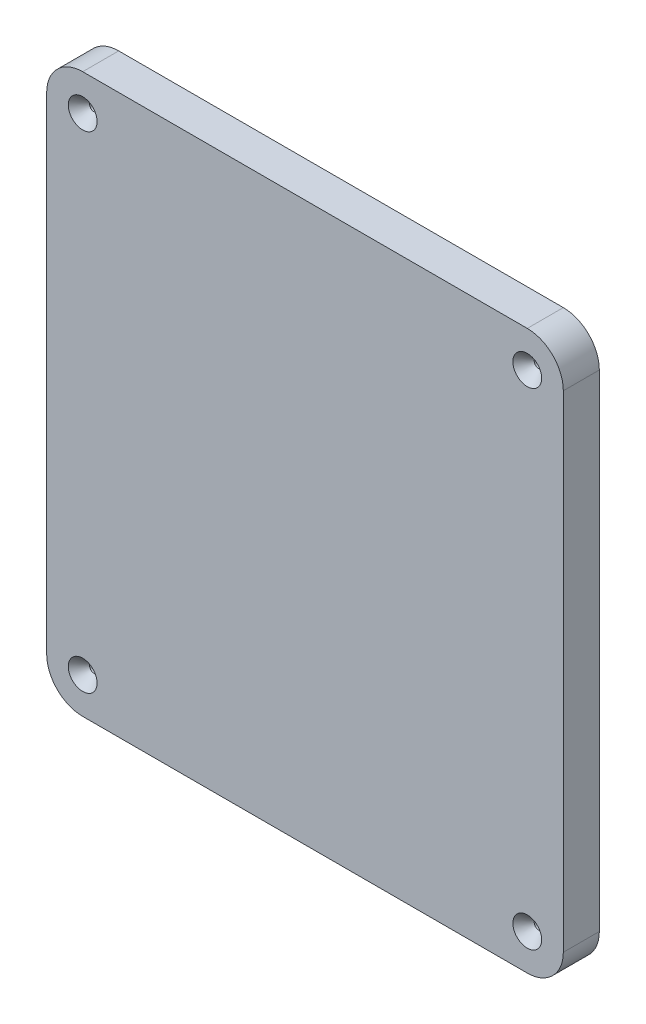
from build123d import *

# Parameters (mm, degrees)
SKETCH1_W           = 182.149999994
SKETCH1_H           = 196.85
BOSS_EXTRUDE1_DEPTH = 12.7
FILLET1_R           = 12.7
HOLE1_D             = 3.175
HOLE1_DEPTH         = 31.75
HOLE1_CSINK_D       = 10.16
HOLE1_CSINK_ANGLE   = 82
HOLE1_TIP           = 0.953866233


with BuildPart() as part:
    # Sketch1 → Boss-Extrude1 (new body)
    with BuildSketch(Plane.XY):
        with Locations((47.975000003, 766.50216301)):
            Rectangle(SKETCH1_W, SKETCH1_H)
    extrude(amount=BOSS_EXTRUDE1_DEPTH)

    # Fillet1
    fillet1_edges = [part.edges().sort_by_distance(p)[0] for p in [
        (139.05, 864.92716301, 6.35),
        (139.05, 668.07716301, 6.35),
        (-43.099999994, 668.07716301, 6.35),
        (-43.099999994, 864.92716301, 6.35),
    ]]
    fillet(fillet1_edges, radius=FILLET1_R)

    # Hole1
    with Locations(Plane(origin=(47.975000003, -457.960607328, 12.7), x_dir=(1, 0, 0), z_dir=(0, 0, 1))):
        with Locations((-78.374999997, 1310.187770337), (-78.374999997, 1138.737770337), (78.374999997, 1138.737770337), (78.374999997, 1310.187770337)):
            CounterSinkHole(HOLE1_D / 2, HOLE1_CSINK_D / 2, depth=HOLE1_DEPTH, counter_sink_angle=HOLE1_CSINK_ANGLE)
            with Locations((0, 0, -(HOLE1_DEPTH + HOLE1_TIP / 2))):  # 118° drill point
                Cone(0, HOLE1_D / 2, HOLE1_TIP, mode=Mode.SUBTRACT)


solid = part.part
